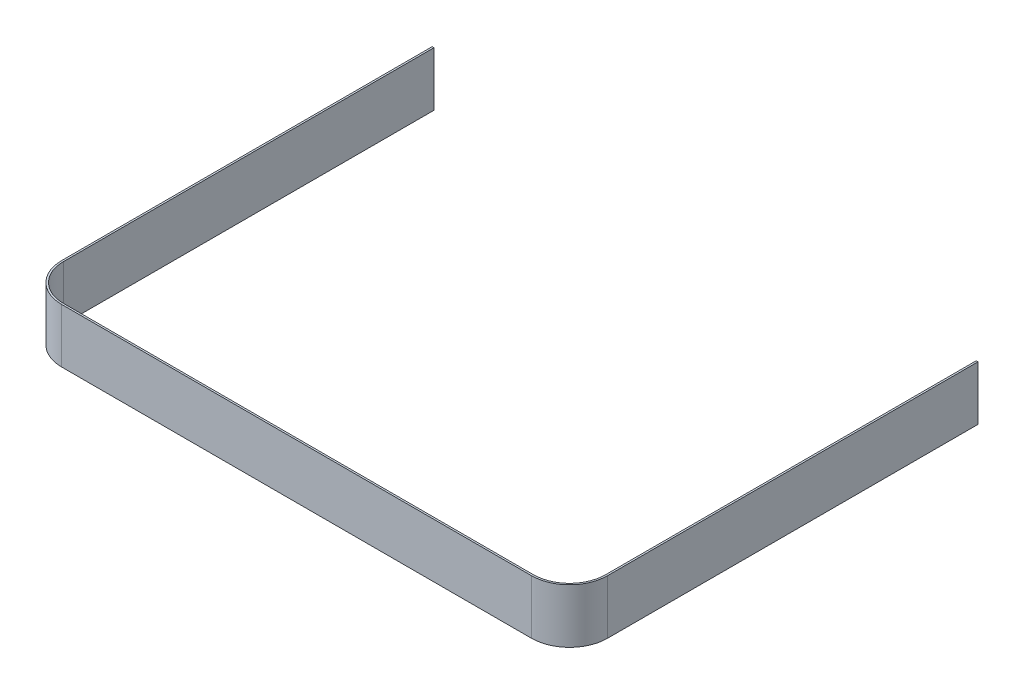
from build123d import *

# Parameters (mm, degrees)
LINEAR_AUSTRAGEN_D_NN1_DEPTH = 30


with BuildPart() as part:
    # Skizze1 → Linear-Austragen-Dünn1 (new body)
    with BuildSketch(Plane.XZ):
        with BuildLine():
            Line((0, 75), (130, 75))
            ThreePointArc((130, 75), (144.142135624, 69.142135624), (150, 55))
            Line((150, 55), (150, -150))
            Line((150, -150), (151, -150))
            Line((151, -150), (151, 55))
            ThreePointArc((151, 55), (144.849242405, 69.849242405), (130, 76))
            Line((130, 76), (0, 76))
            Line((0, 76), (0, 75))
        make_face()
    linear_austragen_d_nn1 = extrude(amount=-LINEAR_AUSTRAGEN_D_NN1_DEPTH)

    # Spiegeln1: Linear-Austragen-Dünn1 across plane
    add(linear_austragen_d_nn1.mirror(Plane(origin=(0, 30, 75), x_dir=(0, 0, 1), z_dir=(1, 0, 0))))


solid = part.part
